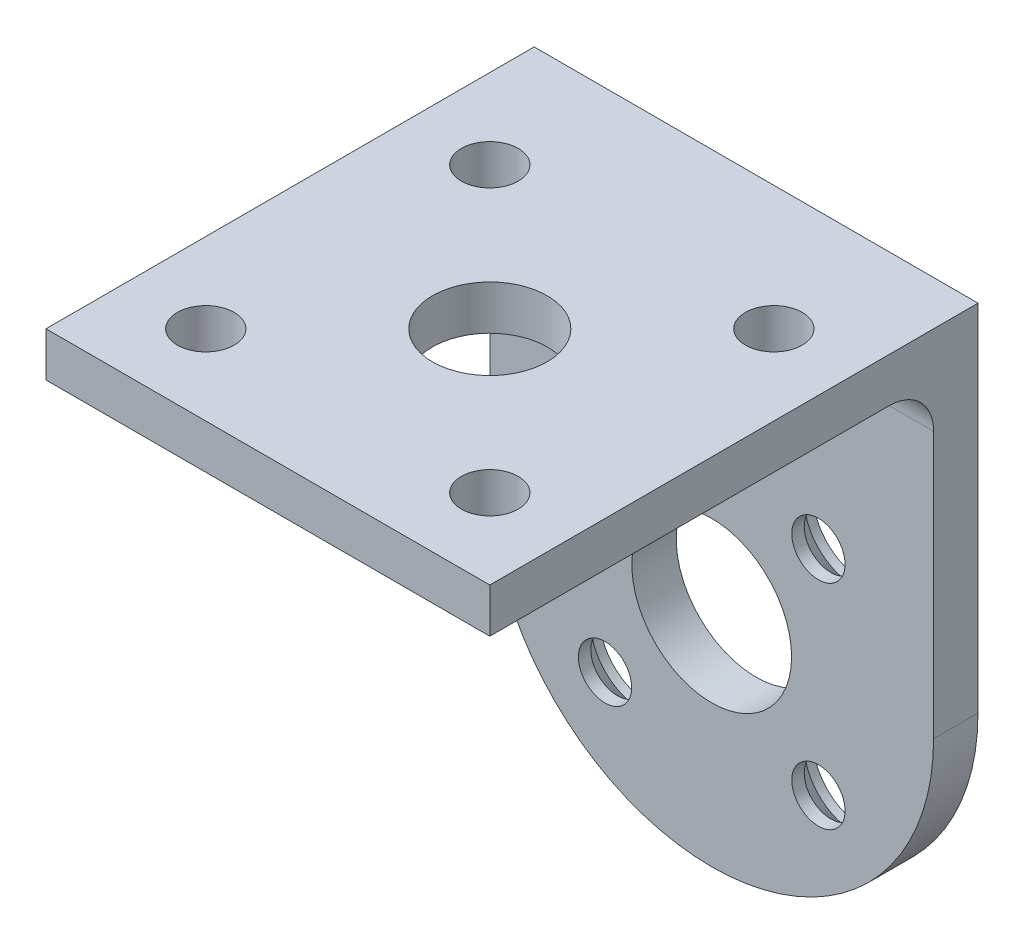
from build123d import *

# Parameters (mm, degrees)
SKETCH1_R           = 2.8
SKETCH1_R_2         = 4.5
BOSS_EXTRUDE1_DEPTH = 2.5
SKETCH2_W           = 25
SKETCH2_H           = 2.5
BOSS_EXTRUDE2_DEPTH = 25
FILLET1_R           = 2.5
SKETCH4_R           = 3.229450522
CUT_EXTRUDE1_DEPTH  = 10
BOSS_EXTRUDE3_START = -2
SKETCH3_R           = 2.8
SKETCH3_R_2         = 1.5
BOSS_EXTRUDE3_DEPTH = 0.5
CHAMFER4_SIZE       = 1.5


with BuildPart() as part:
    # Sketch1 → Boss-Extrude1 (new body)
    with BuildSketch(Plane.XY):
        with BuildLine():
            Line((-12.5, 0), (-12.5, 20))
            Line((-12.5, 20), (12.5, 20))
            Line((12.5, 20), (12.5, 0))
            ThreePointArc((12.5, 0), (0, -12.5), (-12.5, 0))
        make_face()
        with Locations((-6.01040764, 6.01040764)):
            Circle(SKETCH1_R, mode=Mode.SUBTRACT)
        with Locations((-6.01040764, -6.01040764)):
            Circle(SKETCH1_R, mode=Mode.SUBTRACT)
        with Locations((6.01040764, -6.01040764)):
            Circle(SKETCH1_R, mode=Mode.SUBTRACT)
        with Locations((6.01040764, 6.01040764)):
            Circle(SKETCH1_R, mode=Mode.SUBTRACT)
        Circle(SKETCH1_R_2, mode=Mode.SUBTRACT)
    extrude(amount=BOSS_EXTRUDE1_DEPTH)

    # Sketch2 → Boss-Extrude2 (add)
    with BuildSketch(Plane.XY.offset(2.5)):
        with Locations((0, 18.75)):
            Rectangle(SKETCH2_W, SKETCH2_H)
    extrude(amount=BOSS_EXTRUDE2_DEPTH)

    # Fillet1
    fillet1_edges = [part.edges().sort_by_distance(p)[0] for p in [
        (0, 17.5, 2.5),
    ]]
    fillet(fillet1_edges, radius=FILLET1_R)

    # Sketch4 → Cut-Extrude1 (cut)
    with BuildSketch(Plane(origin=(0, 20, 0), x_dir=(1, 0, 0), z_dir=(0, 1, 0))):
        with BuildLine():
            ThreePointArc((-8, -21.4), (-9.13137085, -24.13137085), (-6.4, -23))
            Line((-6.4, -23), (-8, -23))
            Line((-8, -23), (-8, -21.4))
        make_face()
        with BuildLine():
            Line((-8, -23), (-6.4, -23))
            ThreePointArc((-6.4, -23), (-6.86862915, -21.86862915), (-8, -21.4))
            Line((-8, -21.4), (-8, -23))
        make_face()
        with BuildLine():
            ThreePointArc((8, -21.4), (6.86862915, -21.86862915), (6.4, -23))
            Line((6.4, -23), (8, -23))
            Line((8, -23), (8, -21.4))
        make_face()
        with BuildLine():
            Line((8, -23), (6.4, -23))
            ThreePointArc((6.4, -23), (8, -24.6), (9.6, -23))
            ThreePointArc((9.6, -23), (9.13137085, -21.86862915), (8, -21.4))
            Line((8, -21.4), (8, -23))
        make_face()
        with BuildLine():
            ThreePointArc((6.4, -7), (6.86862915, -8.13137085), (8, -8.6))
            Line((8, -8.6), (8, -7))
            Line((8, -7), (6.4, -7))
        make_face()
        with BuildLine():
            Line((8, -7), (8, -8.6))
            ThreePointArc((8, -8.6), (9.13137085, -8.13137085), (9.6, -7))
            ThreePointArc((9.6, -7), (8, -5.4), (6.4, -7))
            Line((6.4, -7), (8, -7))
        make_face()
        with Locations(Location((0, -15, 0), (0, 0, 270))):
            Circle(SKETCH4_R)
        with BuildLine():
            ThreePointArc((-6.4, -7), (-9.13137085, -5.86862915), (-8, -8.6))
            Line((-8, -8.6), (-8, -7))
            Line((-8, -7), (-6.4, -7))
        make_face()
        with BuildLine():
            Line((-8, -7), (-8, -8.6))
            ThreePointArc((-8, -8.6), (-6.86862915, -8.13137085), (-6.4, -7))
            Line((-6.4, -7), (-8, -7))
        make_face()
    extrude(amount=-CUT_EXTRUDE1_DEPTH, mode=Mode.SUBTRACT)

    # Sketch3 → Boss-Extrude3 (add)
    # profile 1 of 4: a face of its own
    with BuildSketch(Plane(origin=(0, 0, 0), x_dir=(-1, 0, 0), z_dir=(0, 0, -1)).offset(BOSS_EXTRUDE3_START)):
        with Locations(Location((-6.01040764, 6.01040764, 0), (0, 0, 180))):
            Circle(SKETCH3_R)
        with Locations(Location((-6.01040764, 6.01040764, 0), (0, 0, 180))):
            Circle(SKETCH3_R_2, mode=Mode.SUBTRACT)
    # profile 2 of 4: a face of its own
    with BuildSketch(Plane(origin=(0, 0, 0), x_dir=(-1, 0, 0), z_dir=(0, 0, -1)).offset(BOSS_EXTRUDE3_START)):
        with Locations(Location((6.01040764, 6.01040764, 0), (0, 0, 180))):
            Circle(SKETCH3_R)
        with Locations(Location((6.01040764, 6.01040764, 0), (0, 0, 180))):
            Circle(SKETCH3_R_2, mode=Mode.SUBTRACT)
    # profile 3 of 4: a face of its own
    with BuildSketch(Plane(origin=(0, 0, 0), x_dir=(-1, 0, 0), z_dir=(0, 0, -1)).offset(BOSS_EXTRUDE3_START)):
        with Locations(Location((6.01040764, -6.01040764, 0), (0, 0, 180))):
            Circle(SKETCH3_R)
        with Locations(Location((6.01040764, -6.01040764, 0), (0, 0, 180))):
            Circle(SKETCH3_R_2, mode=Mode.SUBTRACT)
    # profile 4 of 4: a face of its own
    with BuildSketch(Plane(origin=(0, 0, 0), x_dir=(-1, 0, 0), z_dir=(0, 0, -1)).offset(BOSS_EXTRUDE3_START)):
        with Locations(Location((-6.01040764, -6.01040764, 0), (0, 0, 180))):
            Circle(SKETCH3_R)
        with Locations(Location((-6.01040764, -6.01040764, 0), (0, 0, 180))):
            Circle(SKETCH3_R_2, mode=Mode.SUBTRACT)
    extrude(amount=-BOSS_EXTRUDE3_DEPTH)

    # Chamfer4
    # the kernel refuses this chamfer: 1.5 mm, written as the material it adds along each edge
    with BuildSketch(Plane(origin=(6.01040764, 6.01040764, 2), x_dir=(1, 0, 0), z_dir=(0, 1, 0))) as chamfer4_piece_1_section:
        Polygon((2.8, CHAMFER4_SIZE), (2.8 - CHAMFER4_SIZE, 0), (2.8, 0), align=None)
    chamfer4_piece_1 = revolve(axis=Axis((6.01040764, 6.01040764, 2), (0, 0, -1)), mode=Mode.PRIVATE)
    chamfer4_piece_1 = chamfer4_piece_1 - Plane(origin=(6.01040764, 6.01040764, 1.147189391), x_dir=(1, 0, 0), z_dir=(0, 0, -1)) * Cylinder(1.5, 12, mode=Mode.PRIVATE)
    add(chamfer4_piece_1)
    with BuildSketch(Plane(origin=(-6.01040764, -6.01040764, 2), x_dir=(1, 0, 0), z_dir=(0, 1, 0))) as chamfer4_piece_2_section:
        Polygon((2.8, CHAMFER4_SIZE), (2.8 - CHAMFER4_SIZE, 0), (2.8, 0), align=None)
    chamfer4_piece_2 = revolve(axis=Axis((-6.01040764, -6.01040764, 2), (0, 0, -1)), mode=Mode.PRIVATE)
    chamfer4_piece_2 = chamfer4_piece_2 - Plane(origin=(-6.01040764, -6.01040764, 1.147189391), x_dir=(1, 0, 0), z_dir=(0, 0, -1)) * Cylinder(1.5, 12, mode=Mode.PRIVATE)
    add(chamfer4_piece_2)
    with BuildSketch(Plane(origin=(6.01040764, -6.01040764, 2), x_dir=(1, 0, 0), z_dir=(0, 1, 0))) as chamfer4_piece_3_section:
        Polygon((2.8, CHAMFER4_SIZE), (2.8 - CHAMFER4_SIZE, 0), (2.8, 0), align=None)
    chamfer4_piece_3 = revolve(axis=Axis((6.01040764, -6.01040764, 2), (0, 0, -1)), mode=Mode.PRIVATE)
    chamfer4_piece_3 = chamfer4_piece_3 - Plane(origin=(6.01040764, -6.01040764, 1.147189391), x_dir=(1, 0, 0), z_dir=(0, 0, -1)) * Cylinder(1.5, 12, mode=Mode.PRIVATE)
    add(chamfer4_piece_3)
    with BuildSketch(Plane(origin=(-6.01040764, 6.01040764, 2), x_dir=(1, 0, 0), z_dir=(0, 1, 0))) as chamfer4_piece_4_section:
        Polygon((2.8, CHAMFER4_SIZE), (2.8 - CHAMFER4_SIZE, 0), (2.8, 0), align=None)
    chamfer4_piece_4 = revolve(axis=Axis((-6.01040764, 6.01040764, 2), (0, 0, -1)), mode=Mode.PRIVATE)
    chamfer4_piece_4 = chamfer4_piece_4 - Plane(origin=(-6.01040764, 6.01040764, 1.147189391), x_dir=(1, 0, 0), z_dir=(0, 0, -1)) * Cylinder(1.5, 12, mode=Mode.PRIVATE)
    add(chamfer4_piece_4)


solid = part.part
